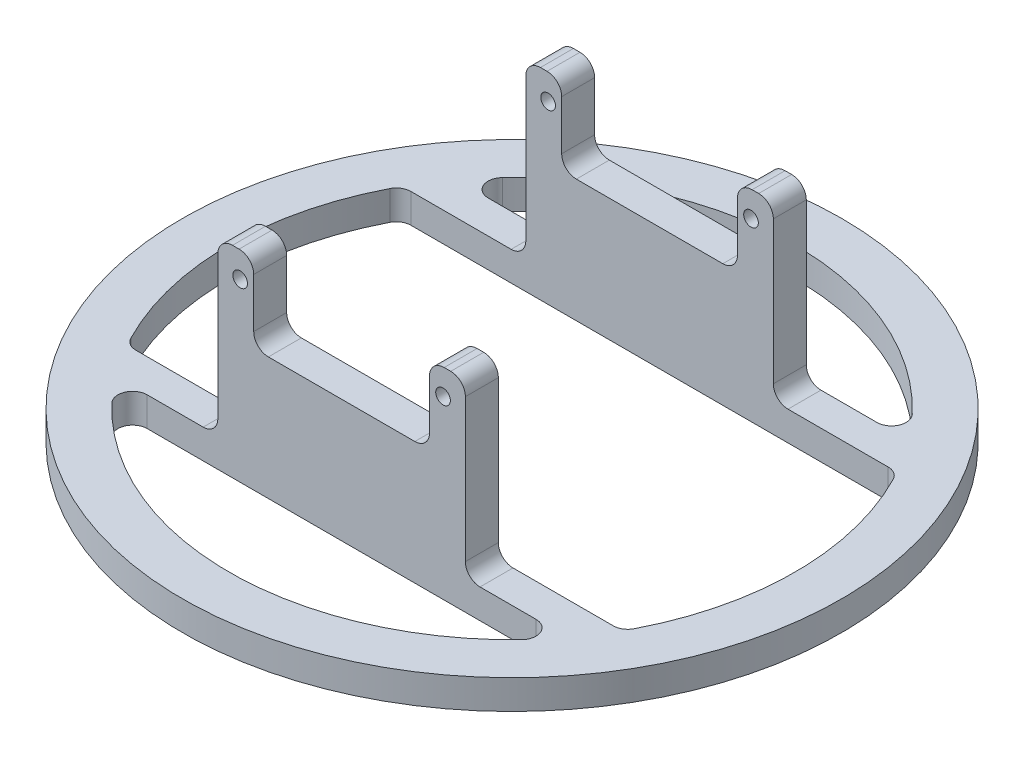
from build123d import *

# Parameters (mm, degrees)
SKETCH1_R           = 1
BOSS_EXTRUDE1_DEPTH = 4.5
SKETCH4_R           = 45
BOSS_EXTRUDE3_DEPTH = 4
FILLET2_R           = 2
FILLET3_R           = 2


with BuildPart() as part:
    # Sketch1 → Boss-Extrude1 (new body)
    with BuildSketch(Plane.XY):
        Polygon((12, 3.5), (16.9, 3.5), (16.9, -20), (-16.9, -20), (-16.9, 3.5), (-12, 3.5), (-12, -7.25), (12, -7.25), align=None)
        with Locations((13.85, 0)):
            Circle(SKETCH1_R, mode=Mode.SUBTRACT)
        with Locations((-13.85, 0)):
            Circle(SKETCH1_R, mode=Mode.SUBTRACT)
    boss_extrude1 = extrude(amount=BOSS_EXTRUDE1_DEPTH)

    # Sketch4 → Boss-Extrude3 (add)
    with BuildSketch(Plane(origin=(0, -20, 0), x_dir=(-1, 0, 0), z_dir=(0, -1, 0))):
        with Locations((0, 18.775)):
            Circle(SKETCH4_R)
        with BuildLine():
            Line((-33.78345564, 0), (33.78345564, 0))
            ThreePointArc((33.78345564, 0), (38.65, 18.775), (33.78345564, 37.55))
            Line((33.78345564, 37.55), (-33.78345564, 37.55))
            ThreePointArc((-33.78345564, 37.55), (-38.65, 18.775), (-33.78345564, 0))
        make_face(mode=Mode.SUBTRACT)
        with BuildLine():
            Line((-30.85606707, -4.5), (30.85606707, -4.5))
            ThreePointArc((30.85606707, -4.5), (0, -19.875), (-30.85606707, -4.5))
        make_face(mode=Mode.SUBTRACT)
        with BuildLine():
            Line((-30.85606707, 42.05), (30.85606707, 42.05))
            ThreePointArc((30.85606707, 42.05), (0, 57.425), (-30.85606707, 42.05))
        make_face(mode=Mode.SUBTRACT)
    extrude(amount=BOSS_EXTRUDE3_DEPTH)

    # Mirror2: Boss-Extrude1 across plane
    add(boss_extrude1.mirror(Plane(origin=(0, 0, -18.775), x_dir=(1, 0, 0), z_dir=(0, 0, -1))))

    # Fillet2
    fillet2_edges = [part.edges().sort_by_distance(p)[0] for p in [
        (-12, -7.25, -39.8),
        (12, -7.25, -39.8),
        (-12, -7.25, 2.25),
        (12, -7.25, 2.25),
        (-33.78345564, -22, 0),
        (-33.78345564, -22, -37.55),
        (-30.85606707, -22, 4.5),
        (30.85606707, -22, 4.5),
        (33.78345564, -22, 0),
        (33.78345564, -22, -37.55),
        (-30.85606707, -22, -42.05),
        (30.85606707, -22, -42.05),
    ]]
    fillet(fillet2_edges, radius=FILLET2_R)

    # Fillet3
    fillet3_edges = [part.edges().sort_by_distance(p)[0] for p in [
        (-16.9, 3.5, 2.25),
        (-12, 3.5, 2.25),
        (12, 3.5, 2.25),
        (16.9, 3.5, 2.25),
        (-16.9, 3.5, -39.8),
        (-12, 3.5, -39.8),
        (12, 3.5, -39.8),
        (16.9, 3.5, -39.8),
        (16.9, -20, 2.25),
        (-16.9, -20, 2.25),
        (-16.9, -20, -39.8),
        (16.9, -20, -39.8),
    ]]
    fillet(fillet3_edges, radius=FILLET3_R)


solid = part.part
